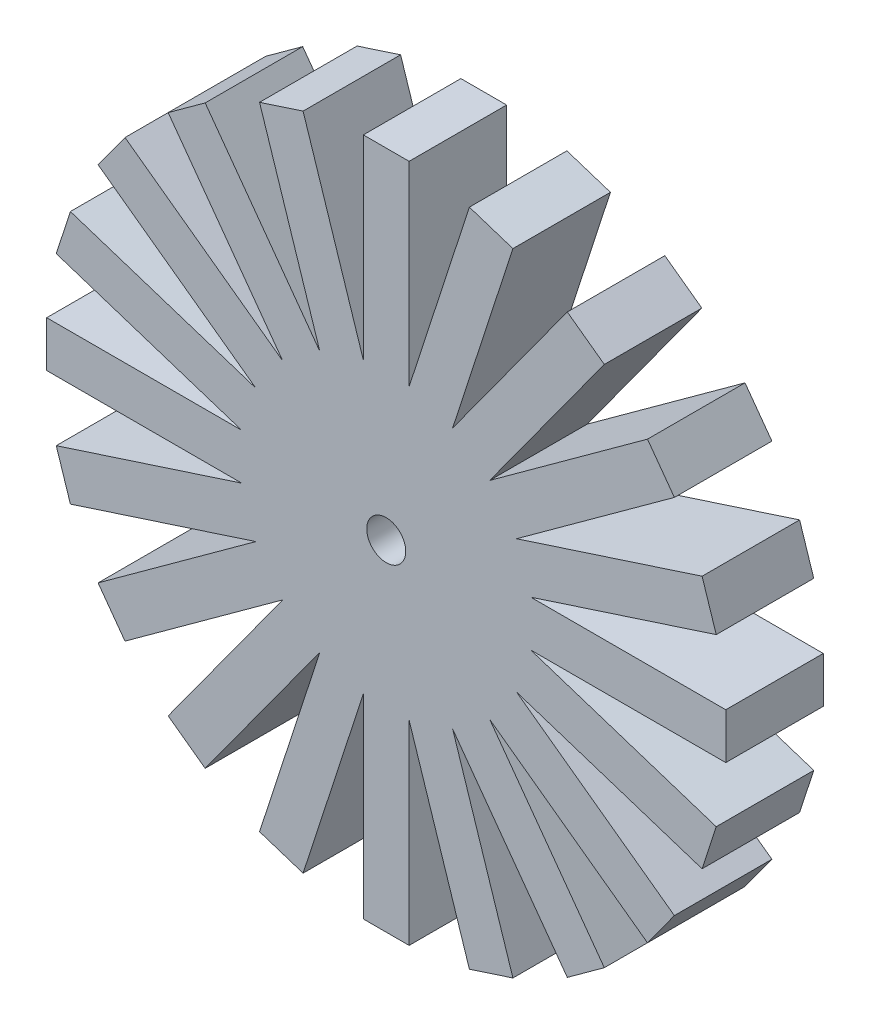
from build123d import *

# Parameters (mm, degrees)
ESQUISSE1_R        = 2
BOSS_EXTRU_1_DEPTH = 10


with BuildPart() as part:
    # Esquisse1 → Boss.-Extru.1 (new body)
    with BuildSketch(Plane.XY):
        Polygon((-32.386228189, -12.990197384), (-13.365097863, -6.809857496), (-29.54543775, -18.565562542), (-26.786941605, -22.362306764), (-10.606601718, -10.606601718), (-22.362306764, -26.786941605), (-18.565562542, -29.54543775), (-6.809857496, -13.365097863), (-12.990197384, -32.386228189), (-8.526856863, -33.836455435), (-2.346516976, -14.815325109), (-2.346516976, -34.815325109), (2.346516976, -34.815325109), (2.346516976, -14.815325109), (8.526856863, -33.836455435), (12.990197384, -32.386228189), (6.809857496, -13.365097863), (18.565562542, -29.54543775), (22.362306764, -26.786941605), (10.606601718, -10.606601718), (26.786941605, -22.362306764), (29.54543775, -18.565562542), (13.365097863, -6.809857496), (32.386228189, -12.990197384), (33.836455435, -8.526856863), (14.815325109, -2.346516976), (34.815325109, -2.346516976), (34.815325109, 2.346516976), (14.815325109, 2.346516976), (33.836455435, 8.526856863), (32.386228189, 12.990197384), (13.365097863, 6.809857496), (29.54543775, 18.565562542), (26.786941605, 22.362306764), (10.606601718, 10.606601718), (22.362306764, 26.786941605), (18.565562542, 29.54543775), (6.809857496, 13.365097863), (12.990197384, 32.386228189), (8.526856863, 33.836455435), (2.346516976, 14.815325109), (2.346516976, 34.815325109), (-2.346516976, 34.815325109), (-2.346516976, 14.815325109), (-8.526856863, 33.836455435), (-12.990197384, 32.386228189), (-6.809857496, 13.365097863), (-18.565562542, 29.54543775), (-22.362306764, 26.786941605), (-10.606601718, 10.606601718), (-26.786941605, 22.362306764), (-29.54543775, 18.565562542), (-13.365097863, 6.809857496), (-32.386228189, 12.990197384), (-33.836455435, 8.526856863), (-14.815325109, 2.346516976), (-34.815325109, 2.346516976), (-34.815325109, -2.346516976), (-14.815325109, -2.346516976), (-33.836455435, -8.526856863), align=None)
        Circle(ESQUISSE1_R, mode=Mode.SUBTRACT)
    extrude(amount=BOSS_EXTRU_1_DEPTH)


solid = part.part
